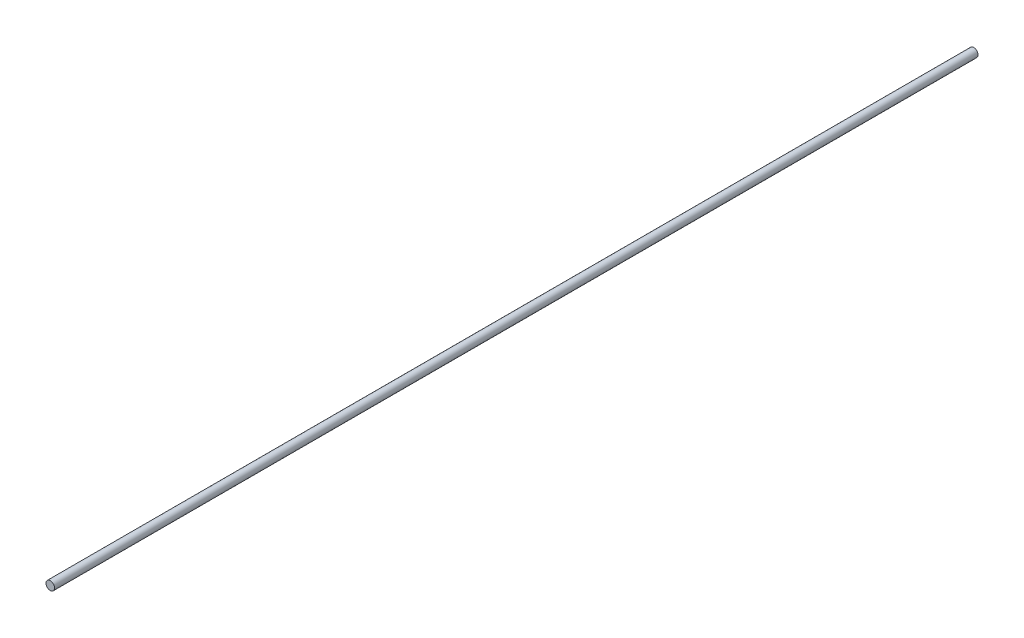
from build123d import *

# Parameters (mm, degrees)
SKETCH1_R           = 7.9375
BOSS_EXTRUDE1_DEPTH = 2254.25
SKETCH2_R           = 7.9375
CUT_EXTRUDE1_DEPTH  = 539.75


with BuildPart() as part:
    # Sketch1 → Boss-Extrude1 (new body)
    with BuildSketch(Plane.XY):
        Circle(SKETCH1_R)
    extrude(amount=BOSS_EXTRUDE1_DEPTH)

    # Sketch2 → Cut-Extrude1 (cut)
    with BuildSketch(Plane(origin=(0, 0, 0), x_dir=(-1, 0, 0), z_dir=(0, 0, -1))):
        Circle(SKETCH2_R)
    extrude(amount=-CUT_EXTRUDE1_DEPTH, mode=Mode.SUBTRACT)


solid = part.part
